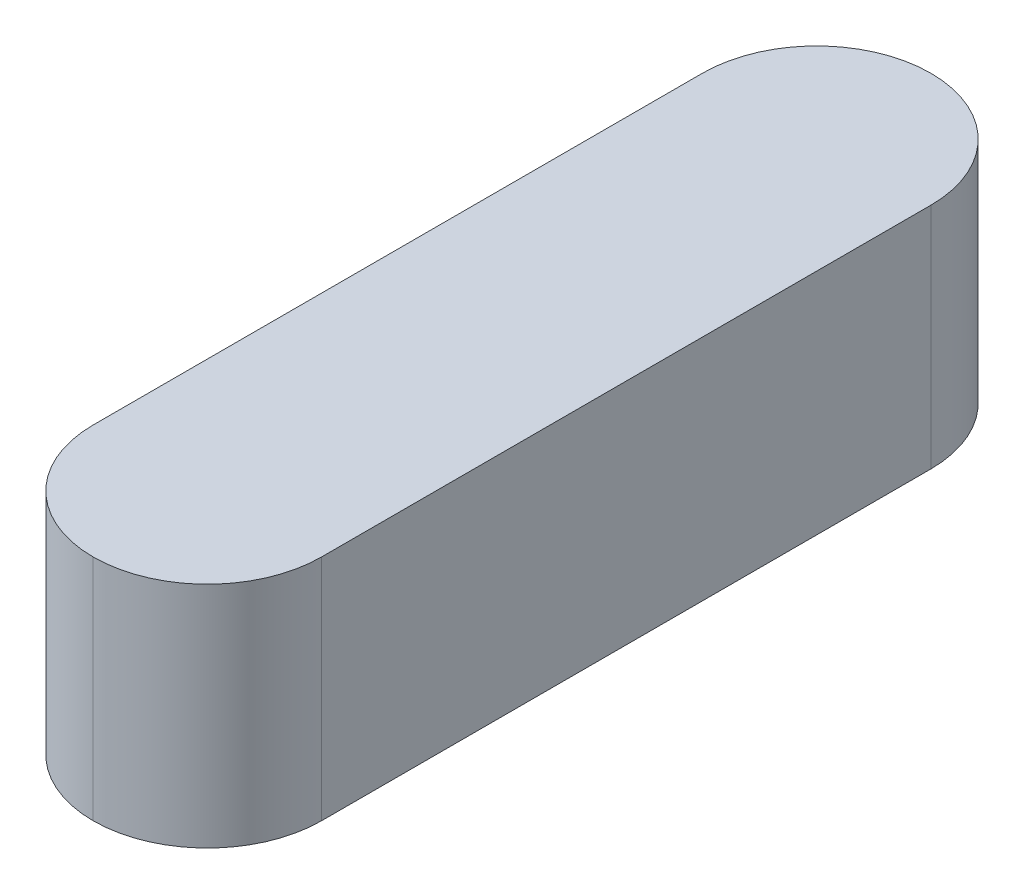
from build123d import *

# Parameters (mm, degrees)
SKETCH1_W      = 6
SKETCH1_H      = 6
EXTRUDE1_DEPTH = 22
FILLET1_R      = 3


with BuildPart() as part:
    # Sketch1 → Extrude1 (new body)
    with BuildSketch(Plane.XY):
        with Locations((3, 4.996296296)):
            Rectangle(SKETCH1_W, SKETCH1_H)
    extrude(amount=EXTRUDE1_DEPTH)

    # Fillet1
    fillet1_edges = [part.edges().sort_by_distance(p)[0] for p in [
        (6, 4.996296296, 22),
        (0, 4.996296296, 22),
        (0, 4.996296296, 0),
        (6, 4.996296296, 0),
    ]]
    fillet(fillet1_edges, radius=FILLET1_R - 0.0001)  # a hair under: the kernel refuses the full size


solid = part.part
